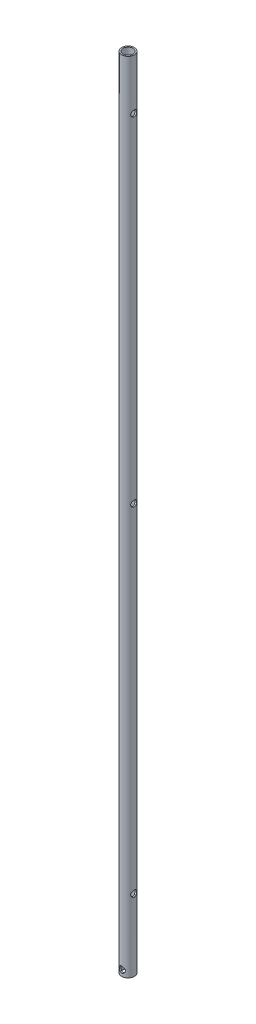
from build123d import *

# Parameters (mm, degrees)
STRUCTURE_SYSTEM1_OUTLINE_R   = 10.65
STRUCTURE_SYSTEM1_OUTLINE_R_2 = 8.35
STRUCTURE_SYSTEM1_DEPTH       = 1338
CUT_EXTRUDE1_DEPTH            = 1339.084767494
CUT_EXTRUDE1_DEPTH_BACK       = 1339.084767494
SKETCH12_R                    = 5
CUT_EXTRUDE2_DEPTH            = 1339.084767596
CUT_EXTRUDE2_DEPTH_BACK       = 1339.084767596
SKETCH15_R                    = 5


# Read off the part's stored shape, not the designer's step: Structure System1
with BuildPart() as part:
    # Structure System1 outline → Structure System1 (new body)
    with BuildSketch(Plane(origin=(0, 0, 0), x_dir=(1, 0, 0), z_dir=(0, 1, 0))):
        Circle(STRUCTURE_SYSTEM1_OUTLINE_R)
        Circle(STRUCTURE_SYSTEM1_OUTLINE_R_2, mode=Mode.SUBTRACT)
    extrude(amount=STRUCTURE_SYSTEM1_DEPTH)

    # Sketch12 → Cut-Extrude1 (cut, two sides: drawn at the far end of the back side and taken through both)
    with BuildSketch(Plane(origin=(0, 0, 0), x_dir=(0, 0, -1), z_dir=(1, 0, 0)).offset(-CUT_EXTRUDE1_DEPTH_BACK)):
        with Locations((0, 1253)):
            Circle(SKETCH12_R)
        with Locations((0, 120.340965739)):
            Circle(SKETCH12_R)
        with Locations((0, 686.670965739)):
            Circle(SKETCH12_R)
    extrude(amount=CUT_EXTRUDE1_DEPTH + CUT_EXTRUDE1_DEPTH_BACK, mode=Mode.SUBTRACT)

    # Sketch15 → Cut-Extrude2 (cut, two sides: drawn at the far end of the back side and taken through both)
    with BuildSketch(Plane.XY.offset(-CUT_EXTRUDE2_DEPTH_BACK)):
        with Locations((0, 10)):
            Circle(SKETCH15_R)
    extrude(amount=CUT_EXTRUDE2_DEPTH + CUT_EXTRUDE2_DEPTH_BACK, mode=Mode.SUBTRACT)


solid = part.part
